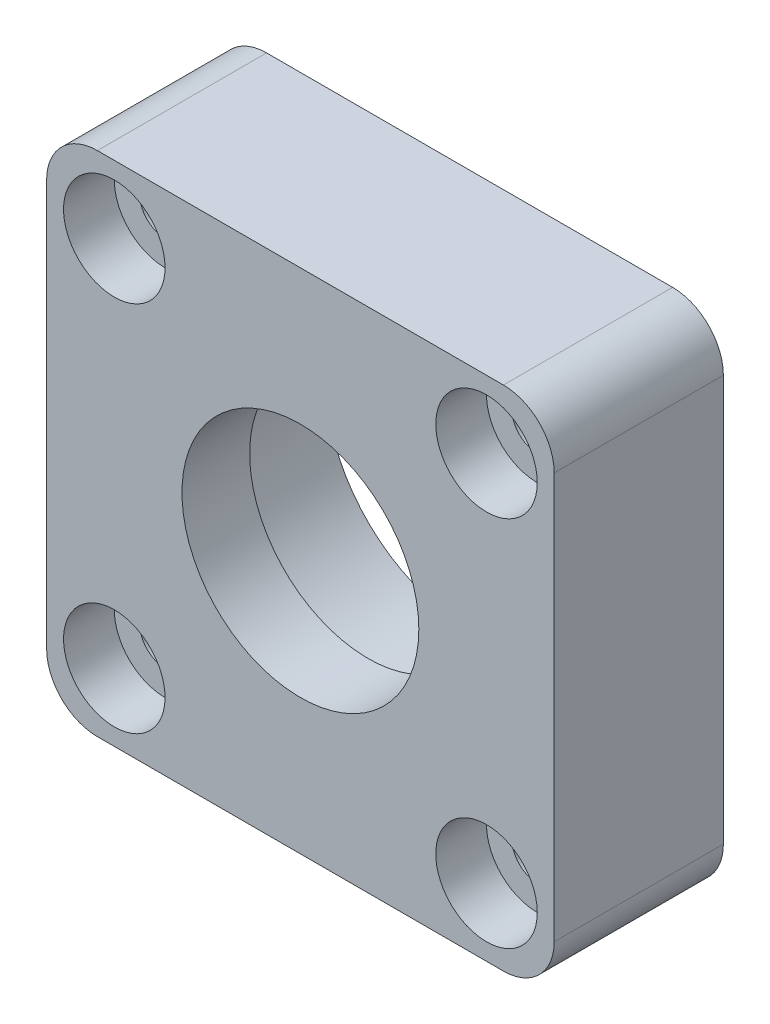
from build123d import *

# Parameters (mm, degrees)
SKETCH1_W           = 30
SKETCH1_H           = 30
SKETCH1_R           = 7
BOSS_EXTRUDE1_DEPTH = 10
SKETCH2_R           = 8.5
CUT_EXTRUDE1_DEPTH  = 6
SKETCH3_R           = 1.5
CUT_EXTRUDE2_DEPTH  = 24.452078799
SKETCH4_R           = 3
CUT_EXTRUDE3_DEPTH  = 3
FILLET1_R           = 3


with BuildPart() as part:
    # Sketch1 → Boss-Extrude1 (new body)
    with BuildSketch(Plane.XY):
        Rectangle(SKETCH1_W, SKETCH1_H)
        Circle(SKETCH1_R, mode=Mode.SUBTRACT)
    extrude(amount=BOSS_EXTRUDE1_DEPTH)

    # Sketch2 → Cut-Extrude1 (cut)
    with BuildSketch(Plane.XY):
        Circle(SKETCH2_R)
    extrude(amount=CUT_EXTRUDE1_DEPTH, mode=Mode.SUBTRACT)

    # Sketch3 → Cut-Extrude2 (cut, through all)
    with BuildSketch(Plane.XY.offset(10)):
        with Locations((-11, 11)):
            Circle(SKETCH3_R)
        with Locations((11, 11)):
            Circle(SKETCH3_R)
        with Locations((11, -11)):
            Circle(SKETCH3_R)
        with Locations((-11, -11)):
            Circle(SKETCH3_R)
    extrude(amount=-CUT_EXTRUDE2_DEPTH, mode=Mode.SUBTRACT)

    # Sketch4 → Cut-Extrude3 (cut)
    with BuildSketch(Plane.XY.offset(10)):
        with Locations((-11, 11)):
            Circle(SKETCH4_R)
        with Locations((11, 11)):
            Circle(SKETCH4_R)
        with Locations((11, -11)):
            Circle(SKETCH4_R)
        with Locations((-11, -11)):
            Circle(SKETCH4_R)
    extrude(amount=-CUT_EXTRUDE3_DEPTH, mode=Mode.SUBTRACT)

    # Fillet1
    fillet1_edges = [part.edges().sort_by_distance(p)[0] for p in [
        (-15, -15, 5),
        (15, -15, 5),
        (15, 15, 5),
        (-15, 15, 5),
    ]]
    fillet(fillet1_edges, radius=FILLET1_R)


solid = part.part
